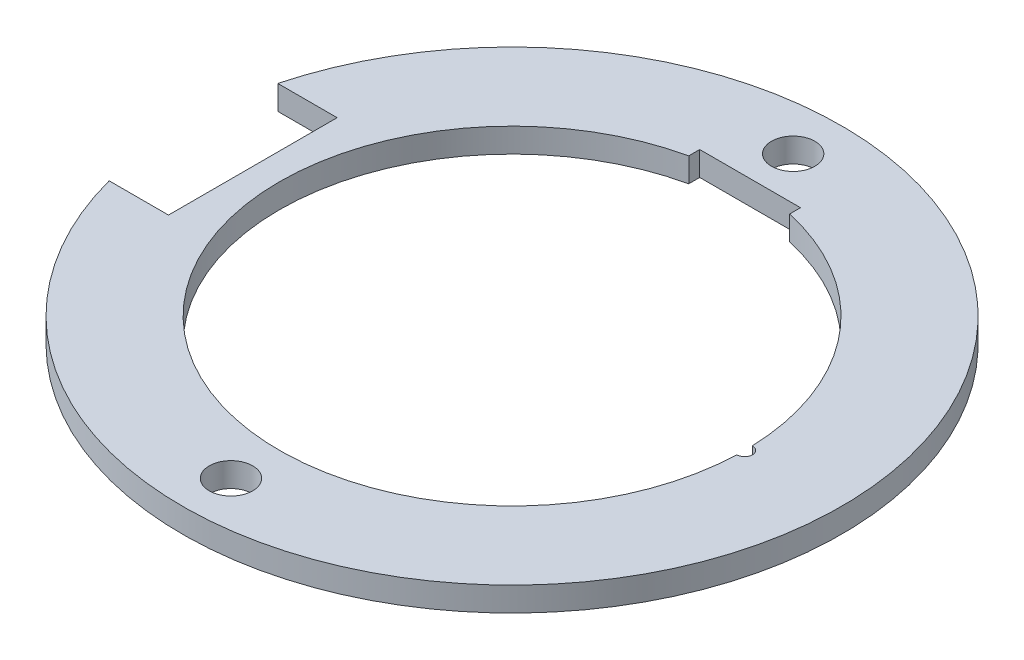
from build123d import *

# Parameters (mm, degrees)
SKETCH1_R           = 21.59
BOSS_EXTRUDE1_DEPTH = 0.79375
SKETCH2_R           = 1.4224
CUT_EXTRUDE1_DEPTH  = 31.574112518
CUT_EXTRUDE2_DEPTH  = 31.574112518
SKETCH4_R           = 0.508
CUT_EXTRUDE3_DEPTH  = 31.574112518


with BuildPart() as part:
    # Sketch1 → Boss-Extrude1 (new, symmetric)
    with BuildSketch(Plane(origin=(0, 0, 0), x_dir=(1, 0, 0), z_dir=(0, 1, 0))):
        Circle(SKETCH1_R)
        with BuildLine():
            Line((-3.302, 14.8779836), (-3.302, 15.5956))
            Line((-3.302, 15.5956), (3.302, 15.5956))
            Line((3.302, 15.5956), (3.302, 14.8779836))
            ThreePointArc((3.302, 14.8779836), (11.8865487, 9.537691545), (15.24, 0))
            ThreePointArc((15.24, 0), (-9.537691545, -11.8865487), (-3.302, 14.8779836))
        make_face(mode=Mode.SUBTRACT)
    extrude(amount=BOSS_EXTRUDE1_DEPTH, both=True)

    # Sketch2 → Cut-Extrude1 (cut, through all)
    with BuildSketch(Plane(origin=(0, 0.79375, 0), x_dir=(1, 0, 0), z_dir=(0, 1, 0))):
        with Locations((0, 18.415)):
            Circle(SKETCH2_R)
        with Locations((0, -18.415)):
            Circle(SKETCH2_R)
    extrude(amount=-CUT_EXTRUDE1_DEPTH, mode=Mode.SUBTRACT)

    # Sketch3 → Cut-Extrude2 (cut, through all)
    with BuildSketch(Plane(origin=(0, 0.79375, 0), x_dir=(1, 0, 0), z_dir=(0, 1, 0))):
        with BuildLine():
            Line((-20.871224203, 5.5245), (-16.984058744, 5.5245))
            Line((-16.984058744, 5.5245), (-16.984058744, -5.5245))
            Line((-16.984058744, -5.5245), (-20.871224203, -5.5245))
            ThreePointArc((-20.871224203, -5.5245), (-21.59, 0), (-20.871224203, 5.5245))
        make_face()
    extrude(amount=-CUT_EXTRUDE2_DEPTH, mode=Mode.SUBTRACT)

    # Sketch4 → Cut-Extrude3 (cut, through all)
    with BuildSketch(Plane(origin=(0, 0.79375, 0), x_dir=(1, 0, 0), z_dir=(0, 1, 0))):
        with Locations((15.24, 0)):
            Circle(SKETCH4_R)
    extrude(amount=-CUT_EXTRUDE3_DEPTH, mode=Mode.SUBTRACT)


solid = part.part
